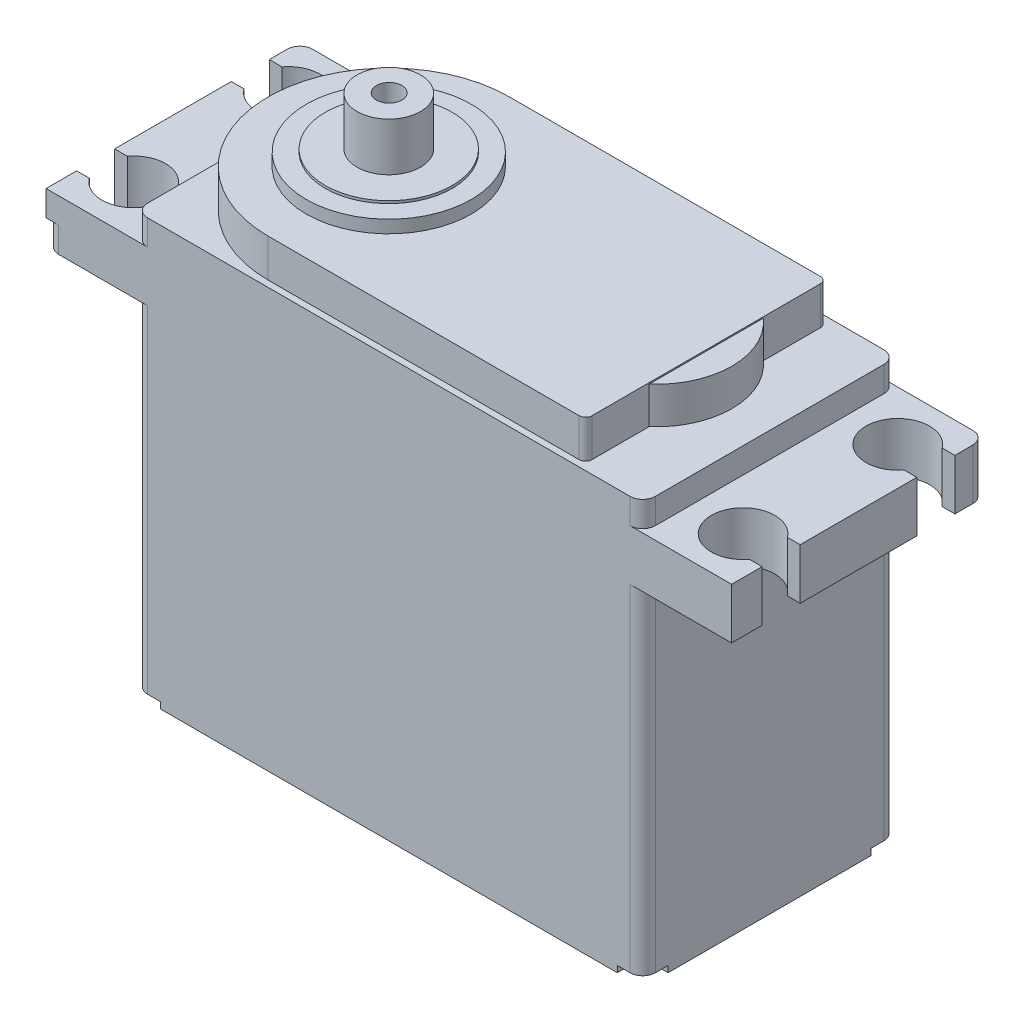
from build123d import *

# Parameters (mm, degrees)
CROQUIS1_W                  = 4
CROQUIS1_H                  = 3.3
SALIENTE_EXTRUIR2_DEPTH     = 2
CORTAR_EXTRUIR1_DEPTH       = 3.3
CORTAR_EXTRUIR2_DEPTH       = 3.3
CORTAR_EXTRUIR16_DEPTH      = 3.32919976
CORTAR_EXTRUIR17_DEPTH      = 3.373498413
SALIENTE_EXTRUIR4_DEPTH     = 0.3
SALIENTE_EXTRUIR5_DEPTH     = 0.29
CROQUIS30_R                 = 0.605268114
SALIENTE_EXTRUIR8_DEPTH     = 0.1
CROQUIS37_R                 = 0.25
SALIENTE_EXTRUIR12_DEPTH    = 0.5
CROQUIS38_R                 = 0.5
SALIENTE_EXTRUIR14_DEPTH    = 0.12
CROQUIS40_R                 = 0.65
SALIENTE_EXTRUIR15_DEPTH    = 0.1
CROQUIS41_R                 = 0.1
SALIENTE_EXTRUIR17_DEPTH    = 0.12
CROQUIS42_R                 = 0.1
CORTAR_EXTRUIR18_DEPTH      = 0.38
SALIENTE_EXTRUIR18_START    = -0.24669491
SALIENTE_EXTRUIR18_DEPTH    = 0.94669491
CORTAR_EXTRUIR20_DEPTH      = 0.7
CORTAR_EXTRUIR21_DEPTH      = 0.7
CORTAR_EXTRUIR24_DEPTH      = 0.7
SALIENTE_EXTRUIR19_DEPTH    = 0.05
SALIENTE_EXTRUIR20_DEPTH    = 0.05
SIMETR_A3_START             = -18.283997871
SIMETR_A3_DEPTH             = 0.4
SIMETR_A3_START_2           = -18.083997871
SIMETR_A3_2_DEPTH           = 0.2
CROQUIS65_W                 = 0.270146479
CROQUIS65_H                 = 0.05
CORTAR_EXTRUIR27_DEPTH      = 2.453147
SALIENTE_EXTRUIR21_DEPTH    = 0.1
CORTAR_EXTRUIR29_DEPTH      = 0.1
CROQUIS70_R                 = 0.05
CORTAR_EXTRUIR30_DEPTH      = 0.1
CORTAR_EXTRUIR33_DEPTH      = 62.802270977
CORTAR_EXTRUIR33_DEPTH_BACK = 0.05


# Read off the part's stored shape, not the designer's step: Simetría3
with BuildPart() as part:
    # Croquis1 → Saliente-Extruir2 (new body)
    with BuildSketch(Plane.XY):
        with Locations((-58.933681522, -19.333997871)):
            Rectangle(CROQUIS1_W, CROQUIS1_H)
    extrude(amount=SALIENTE_EXTRUIR2_DEPTH)

    # Croquis2 → Cortar-Extruir1 (cut)
    with BuildSketch(Plane(origin=(0, -17.683997871, 0), x_dir=(1, 0, 0), z_dir=(0, 1, 0))):
        with BuildLine():
            Line((-60.933681522, 0), (-60.933681522, -0.1))
            ThreePointArc((-60.933681522, -0.1), (-60.9043922, -0.029289322), (-60.833681522, 0))
            Line((-60.833681522, 0), (-60.933681522, 0))
        make_face()
    extrude(amount=-CORTAR_EXTRUIR1_DEPTH, mode=Mode.SUBTRACT)

    # Croquis3 → Cortar-Extruir2 (cut)
    with BuildSketch(Plane(origin=(0, -17.683997871, 0), x_dir=(1, 0, 0), z_dir=(0, 1, 0))):
        with BuildLine():
            Line((-60.933681522, -2), (-60.933681522, -1.9))
            ThreePointArc((-60.933681522, -1.9), (-60.9043922, -1.970710678), (-60.833681522, -2))
            Line((-60.833681522, -2), (-60.933681522, -2))
        make_face()
    extrude(amount=-CORTAR_EXTRUIR2_DEPTH, mode=Mode.SUBTRACT)

    # Croquis14 → Cortar-Extruir16 (cut)
    with BuildSketch(Plane(origin=(0, -17.683997871, 0), x_dir=(1, 0, 0), z_dir=(0, 1, 0))):
        with BuildLine():
            Line((-57.033681522, -2), (-56.933681522, -2))
            Line((-56.933681522, -2), (-56.933681522, -1.9))
            ThreePointArc((-56.933681522, -1.9), (-56.962970843, -1.970710678), (-57.033681522, -2))
        make_face()
    extrude(amount=-CORTAR_EXTRUIR16_DEPTH, mode=Mode.SUBTRACT)

    # Croquis20 → Cortar-Extruir17 (cut)
    with BuildSketch(Plane(origin=(0, -17.683997871, 0), x_dir=(1, 0, 0), z_dir=(0, 1, 0))):
        with BuildLine():
            Line((-56.933681522, -0.1), (-56.933681522, 0))
            Line((-56.933681522, 0), (-57.033681522, 0))
            ThreePointArc((-57.033681522, 0), (-56.962970843, -0.029289322), (-56.933681522, -0.1))
        make_face()
    extrude(amount=-CORTAR_EXTRUIR17_DEPTH, mode=Mode.SUBTRACT)

    # Croquis22 → Saliente-Extruir4 (add)
    with BuildSketch(Plane(origin=(0, -17.683997871, 0), x_dir=(1, 0, 0), z_dir=(0, 1, 0))):
        with BuildLine():
            Line((-59.933681522, -0.05), (-57.483681522, -0.05))
            ThreePointArc((-57.483681522, -0.05), (-57.448326183, -0.064644661), (-57.433681522, -0.1))
            Line((-57.433681522, -0.1), (-57.433681522, -1.9))
            ThreePointArc((-57.433681522, -1.9), (-57.448326183, -1.935355339), (-57.483681522, -1.95))
            Line((-57.483681522, -1.95), (-59.933681522, -1.95))
            ThreePointArc((-59.933681522, -1.95), (-60.883681522, -1), (-59.933681522, -0.05))
        make_face()
    extrude(amount=SALIENTE_EXTRUIR4_DEPTH)

    # Croquis29 → Saliente-Extruir5 (add)
    with BuildSketch(Plane(origin=(0, -17.683997871, 0), x_dir=(1, 0, 0), z_dir=(0, 1, 0))):
        with BuildLine():
            Line((-57.433681522, -1.45), (-57.433681522, -0.55))
            ThreePointArc((-57.433681522, -0.55), (-57.230121698, -1), (-57.433681522, -1.45))
        make_face()
    extrude(amount=SALIENTE_EXTRUIR5_DEPTH)

    # Croquis30 → Saliente-Extruir8 (add)
    with BuildSketch(Plane(origin=(0, -17.383997871, 0), x_dir=(1, 0, 0), z_dir=(0, 1, 0))):
        with Locations(Location((-59.933681522, -1, 0), (0, 0, 270))):
            Circle(CROQUIS30_R)
    extrude(amount=SALIENTE_EXTRUIR8_DEPTH)

    # Croquis37 → Saliente-Extruir12 (add)
    with BuildSketch(Plane(origin=(0, -17.383997871, 0), x_dir=(1, 0, 0), z_dir=(0, 1, 0))):
        with Locations(Location((-59.933681522, -1, 0), (0, 0, 270))):
            Circle(CROQUIS37_R)
    extrude(amount=SALIENTE_EXTRUIR12_DEPTH)

    # Croquis38 → Saliente-Extruir14 (add)
    with BuildSketch(Plane(origin=(0, -17.383997871, 0), x_dir=(1, 0, 0), z_dir=(0, 1, 0))):
        with Locations(Location((-59.933681522, -1, 0), (0, 0, 270))):
            Circle(CROQUIS38_R)
    extrude(amount=SALIENTE_EXTRUIR14_DEPTH)

    # Croquis40 → Saliente-Extruir15 (add)
    with BuildSketch(Plane(origin=(0, -17.383997871, 0), x_dir=(1, 0, 0), z_dir=(0, 1, 0))):
        with Locations(Location((-59.933681522, -1, 0), (0, 0, 270))):
            Circle(CROQUIS40_R)
    extrude(amount=SALIENTE_EXTRUIR15_DEPTH)

    # Croquis41 → Saliente-Extruir17 (add)
    with BuildSketch(Plane(origin=(0, -17.383997871, 0), x_dir=(1, 0, 0), z_dir=(0, 1, 0))):
        with Locations((-59.933681522, -1)):
            Circle(CROQUIS41_R)
    extrude(amount=SALIENTE_EXTRUIR17_DEPTH)

    # Croquis42 → Cortar-Extruir18 (cut)
    with BuildSketch(Plane(origin=(0, -16.883997871, 0), x_dir=(1, 0, 0), z_dir=(0, 1, 0))):
        with Locations(Location((-59.934910889, -0.995862689, 0), (0, 0, 270))):
            Circle(CROQUIS42_R)
    extrude(amount=-CORTAR_EXTRUIR18_DEPTH, mode=Mode.SUBTRACT)

    # Croquis44 → Saliente-Extruir18 (add)
    with BuildSketch(Plane.ZY.offset(60.933681522).offset(SALIENTE_EXTRUIR18_START)):
        Polygon((0.1, -18.083997871), (2, -18.083997871), (2, -18.283997871), (0, -18.283997871), (0, -18.083997871), align=None)
    extrude(amount=SALIENTE_EXTRUIR18_DEPTH)

    # Croquis48 → Cortar-Extruir20 (cut)
    with BuildSketch(Plane(origin=(0, -18.083997871, 0), x_dir=(1, 0, 0), z_dir=(0, 1, 0))):
        with BuildLine():
            Line((-61.633681522, -2), (-61.533681522, -2))
            ThreePointArc((-61.533681522, -2), (-61.6043922, -1.970710678), (-61.633681522, -1.9))
            Line((-61.633681522, -1.9), (-61.633681522, -2))
        make_face()
    extrude(amount=-CORTAR_EXTRUIR20_DEPTH, mode=Mode.SUBTRACT)

    # Croquis49 → Cortar-Extruir21 (cut)
    with BuildSketch(Plane(origin=(0, -18.083997871, 0), x_dir=(1, 0, 0), z_dir=(0, 1, 0))):
        with BuildLine():
            Line((-61.633681522, 0), (-61.633681522, -0.1))
            ThreePointArc((-61.633681522, -0.1), (-61.6043922, -0.029289322), (-61.533681522, 0))
            Line((-61.533681522, 0), (-61.633681522, 0))
        make_face()
    extrude(amount=-CORTAR_EXTRUIR21_DEPTH, mode=Mode.SUBTRACT)

    # Croquis50 → Cortar-Extruir24 (cut)
    with BuildSketch(Plane(origin=(0, -18.083997871, 0), x_dir=(1, 0, 0), z_dir=(0, 1, 0))):
        with BuildLine():
            Line((-61.633681522, -0.240689564), (-61.533681522, -0.240689564))
            ThreePointArc((-61.533681522, -0.240689564), (-61.083681522, -0.390689564), (-61.533681522, -0.540689564))
            Line((-61.533681522, -0.540689564), (-61.633681522, -0.540689564))
            Line((-61.633681522, -0.540689564), (-61.633681522, -0.240689564))
        make_face()
        with BuildLine():
            Line((-61.633681522, -1.459310436), (-61.533681522, -1.459310436))
            ThreePointArc((-61.533681522, -1.459310436), (-61.083681522, -1.609310436), (-61.533681522, -1.759310436))
            Line((-61.533681522, -1.759310436), (-61.633681522, -1.759310436))
            Line((-61.633681522, -1.759310436), (-61.633681522, -1.459310436))
        make_face()
    extrude(amount=-CORTAR_EXTRUIR24_DEPTH, mode=Mode.SUBTRACT)

    # Croquis54 → Saliente-Extruir19 (add)
    with BuildSketch(Plane(origin=(0, -18.083997871, 0), x_dir=(1, 0, 0), z_dir=(0, 1, 0))):
        with BuildLine():
            Line((-60.933681522, -1), (-60.933681522, -0.95))
            Line((-60.933681522, -0.95), (-61.223681522, -0.95))
            ThreePointArc((-61.223681522, -0.95), (-61.230752589, -0.952928932), (-61.233681522, -0.96))
            Line((-61.233681522, -0.96), (-61.233681522, -1.04))
            ThreePointArc((-61.233681522, -1.04), (-61.230752589, -1.047071068), (-61.223681522, -1.05))
            Line((-61.223681522, -1.05), (-60.933681522, -1.05))
            Line((-60.933681522, -1.05), (-60.933681522, -1))
        make_face()
    extrude(amount=SALIENTE_EXTRUIR19_DEPTH)

    # Croquis59 → Saliente-Extruir20 (add)
    with BuildSketch(Plane(origin=(0, 0, 0), x_dir=(-1, 0, 0), z_dir=(0, 0, -1))):
        Polygon((58.933681522, -20.569428407), (58.933681522, -18.401659744), (58.933681522, -18.116282604), (58.663535043, -18.116282604), (58.663535043, -20.569428407), align=None)
    extrude(amount=SALIENTE_EXTRUIR20_DEPTH)

    # Simetría3 outline → Simetría3 (add)
    with BuildSketch(Plane(origin=(0, 0, 0), x_dir=(1, 0, 0), z_dir=(0, 1, 0)).offset(SIMETR_A3_START)):
        with BuildLine():
            Line((-56.233681522, -0.240689564), (-56.233681522, -0.1))
            ThreePointArc((-56.233681522, -0.1), (-56.262970843, -0.029289321), (-56.333681522, 0))
            Line((-56.333681522, 0), (-57.033681522, 0))
            ThreePointArc((-57.033681522, 0), (-56.962970844, -0.029289321), (-56.933681522, -0.1))
            Line((-56.933681522, -0.1), (-56.933681522, -1.9))
            ThreePointArc((-56.933681522, -1.9), (-56.962970844, -1.970710679), (-57.033681522, -2))
            Line((-57.033681522, -2), (-56.233681522, -2))
            Line((-56.233681522, -2), (-56.233681522, -1.759310436))
            Line((-56.233681522, -1.759310436), (-56.333681522, -1.759310436))
            ThreePointArc((-56.333681522, -1.759310436), (-56.783681522, -1.609310436), (-56.333681522, -1.459310436))
            Line((-56.333681522, -1.459310436), (-56.233681522, -1.459310436))
            Line((-56.233681522, -1.459310436), (-56.233681522, -0.540689564))
            Line((-56.233681522, -0.540689564), (-56.333681522, -0.540689564))
            ThreePointArc((-56.333681522, -0.540689564), (-56.783681522, -0.390689564), (-56.333681522, -0.240689564))
            Line((-56.333681522, -0.240689564), (-56.233681522, -0.240689564))
        make_face()
        with BuildLine():
            Line((-60.933681522, -1.05), (-60.933681522, -0.95))
            Line((-60.933681522, -0.95), (-61.223681522, -0.95))
            ThreePointArc((-61.223681522, -0.95), (-61.230752589, -0.952928933), (-61.233681522, -0.96))
            Line((-61.233681522, -0.96), (-61.233681522, -1.04))
            ThreePointArc((-61.233681522, -1.04), (-61.230752589, -1.047071067), (-61.223681522, -1.05))
            Line((-61.223681522, -1.05), (-60.933681522, -1.05))
        make_face()
    extrude(amount=SIMETR_A3_DEPTH)

    # Simetr_a3 2 outline → Simetr_a3 2 (add)
    with BuildSketch(Plane(origin=(0, 0, 0), x_dir=(1, 0, 0), z_dir=(0, 1, 0)).offset(SIMETR_A3_START_2)):
        with BuildLine():
            ThreePointArc((-60.933681522, -0.1), (-60.9043922, -0.029289322), (-60.833681522, 0))
            Line((-60.833681522, 0), (-61.533681522, 0))
            ThreePointArc((-61.533681522, 0), (-61.6043922, -0.029289322), (-61.633681522, -0.1))
            Line((-61.633681522, -0.1), (-61.633681522, -0.240689564))
            Line((-61.633681522, -0.240689564), (-61.533681522, -0.240689564))
            ThreePointArc((-61.533681522, -0.240689564), (-61.083681522, -0.390689564), (-61.533681522, -0.540689564))
            Line((-61.533681522, -0.540689564), (-61.633681522, -0.540689564))
            Line((-61.633681522, -0.540689564), (-61.633681522, -1.459310436))
            Line((-61.633681522, -1.459310436), (-61.533681522, -1.459310436))
            ThreePointArc((-61.533681522, -1.459310436), (-61.083681522, -1.609310436), (-61.533681522, -1.759310436))
            Line((-61.533681522, -1.759310436), (-61.633681522, -1.759310436))
            Line((-61.633681522, -1.759310436), (-61.633681522, -2))
            Line((-61.633681522, -2), (-60.833681522, -2))
            ThreePointArc((-60.833681522, -2), (-60.9043922, -1.970710678), (-60.933681522, -1.9))
            Line((-60.933681522, -1.9), (-60.933681522, -1.05))
            Line((-60.933681522, -1.05), (-61.223681522, -1.05))
            ThreePointArc((-61.223681522, -1.05), (-61.230752589, -1.047071067), (-61.233681522, -1.04))
            Line((-61.233681522, -1.04), (-61.233681522, -0.96))
            ThreePointArc((-61.233681522, -0.96), (-61.230752589, -0.952928933), (-61.223681522, -0.95))
            Line((-61.223681522, -0.95), (-60.933681522, -0.95))
            Line((-60.933681522, -0.95), (-60.933681522, -0.1))
        make_face()
    extrude(amount=SIMETR_A3_2_DEPTH)

    # Croquis65 → Cortar-Extruir27 (cut)
    with BuildSketch(Plane(origin=(0, -18.116282604, 0), x_dir=(1, 0, 0), z_dir=(0, 1, 0))):
        with Locations((-58.798608282, 0.025)):
            Rectangle(CROQUIS65_W, CROQUIS65_H)
    extrude(amount=-CORTAR_EXTRUIR27_DEPTH, mode=Mode.SUBTRACT)

    # Croquis67 → Saliente-Extruir21 (add)
    with BuildSketch(Plane.ZY.offset(60.933681522)):
        Polygon((1, -20.883997871), (1.3, -20.883997871), (1.3, -20.583997871), (0.7, -20.583997871), (0.7, -20.883997871), align=None)
    extrude(amount=SALIENTE_EXTRUIR21_DEPTH)

    # Croquis68 → Cortar-Extruir29 (cut)
    with BuildSketch(Plane.ZY.offset(61.033681522)):
        with BuildLine():
            ThreePointArc((0.7, -20.683997871), (0.729289322, -20.613287193), (0.8, -20.583997871))
            Line((0.8, -20.583997871), (0.7, -20.583997871))
            Line((0.7, -20.583997871), (0.7, -20.683997871))
        make_face()
        with BuildLine():
            ThreePointArc((0.8, -20.883997871), (0.729289322, -20.85470855), (0.7, -20.783997871))
            Line((0.7, -20.783997871), (0.7, -20.883997871))
            Line((0.7, -20.883997871), (0.8, -20.883997871))
        make_face()
        with BuildLine():
            Line((1.3, -20.883997871), (1.3, -20.783997871))
            ThreePointArc((1.3, -20.783997871), (1.270710678, -20.85470855), (1.2, -20.883997871))
            Line((1.2, -20.883997871), (1.3, -20.883997871))
        make_face()
        with BuildLine():
            Line((1.3, -20.583997871), (1.2, -20.583997871))
            ThreePointArc((1.2, -20.583997871), (1.270710678, -20.613287193), (1.3, -20.683997871))
            Line((1.3, -20.683997871), (1.3, -20.583997871))
        make_face()
    extrude(amount=-CORTAR_EXTRUIR29_DEPTH, mode=Mode.SUBTRACT)

    # Croquis70 → Cortar-Extruir30 (cut)
    with BuildSketch(Plane.ZY.offset(61.033681522)):
        with Locations((1.125582476, -20.733997871)):
            Circle(CROQUIS70_R)
        with Locations((1, -20.733997871)):
            Circle(CROQUIS70_R)
        with Locations((0.8770362, -20.733997871)):
            Circle(CROQUIS70_R)
    extrude(amount=-CORTAR_EXTRUIR30_DEPTH, mode=Mode.SUBTRACT)

    # Croquis71 → Cortar-Extruir33 (cut, two sides: drawn at the far end of the back side and taken through both)
    with BuildSketch(Plane.XZ.offset(20.983997871).offset(-CORTAR_EXTRUIR33_DEPTH_BACK)):
        with BuildLine():
            Line((-57.033681522, 2), (-57.133681522, 2))
            Line((-57.133681522, 2), (-57.133681522, 1.9))
            ThreePointArc((-57.133681522, 1.9), (-57.1043922, 1.829289322), (-57.033681522, 1.8))
            Line((-57.033681522, 1.8), (-56.933681522, 1.8))
            Line((-56.933681522, 1.8), (-56.933681522, 1.9))
            ThreePointArc((-56.933681522, 1.9), (-56.962970843, 1.970710678), (-57.033681522, 2))
        make_face()
        with BuildLine():
            Line((-57.133681522, 0.1), (-57.133681522, 0))
            Line((-57.133681522, 0), (-57.033681522, 0))
            ThreePointArc((-57.033681522, 0), (-56.962970843, 0.029289322), (-56.933681522, 0.1))
            Line((-56.933681522, 0.1), (-56.933681522, 0.2))
            Line((-56.933681522, 0.2), (-57.033681522, 0.2))
            ThreePointArc((-57.033681522, 0.2), (-57.1043922, 0.170710678), (-57.133681522, 0.1))
        make_face()
        with BuildLine():
            Line((-60.833681522, 0), (-60.733681522, 0))
            Line((-60.733681522, 0), (-60.733681522, 0.1))
            ThreePointArc((-60.733681522, 0.1), (-60.762970843, 0.170710678), (-60.833681522, 0.2))
            Line((-60.833681522, 0.2), (-60.933681522, 0.2))
            Line((-60.933681522, 0.2), (-60.933681522, 0.1))
            ThreePointArc((-60.933681522, 0.1), (-60.9043922, 0.029289322), (-60.833681522, 0))
        make_face()
        with BuildLine():
            ThreePointArc((-60.833681522, 2), (-60.9043922, 1.970710678), (-60.933681522, 1.9))
            Line((-60.933681522, 1.9), (-60.933681522, 1.8))
            Line((-60.933681522, 1.8), (-60.833681522, 1.8))
            ThreePointArc((-60.833681522, 1.8), (-60.762970843, 1.829289322), (-60.733681522, 1.9))
            Line((-60.733681522, 1.9), (-60.733681522, 2))
            Line((-60.733681522, 2), (-60.833681522, 2))
        make_face()
    extrude(amount=CORTAR_EXTRUIR33_DEPTH + CORTAR_EXTRUIR33_DEPTH_BACK, mode=Mode.SUBTRACT)


solid = part.part
